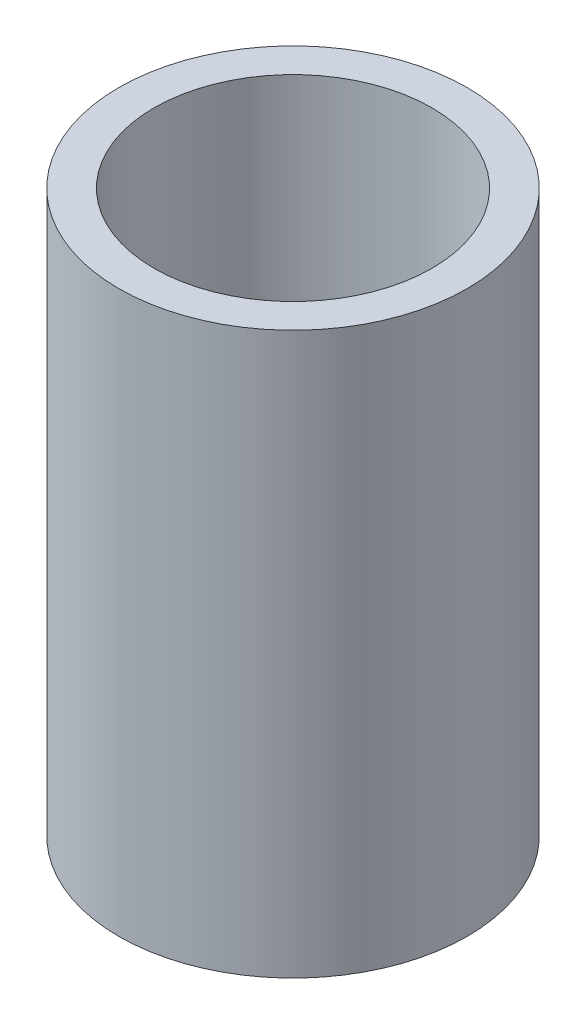
from build123d import *

# Parameters (mm, degrees)
SKETCH1_R           = 15
BOSS_EXTRUDE1_DEPTH = 48.322890663
SKETCH2_R           = 11.972153353
CUT_EXTRUDE1_DEPTH  = 53.774063346


with BuildPart() as part:
    # Sketch1 → Boss-Extrude1 (new body)
    with BuildSketch(Plane(origin=(0, 0, 0), x_dir=(1, 0, 0), z_dir=(0, 1, 0))):
        Circle(SKETCH1_R)
    extrude(amount=BOSS_EXTRUDE1_DEPTH)

    # Sketch2 → Cut-Extrude1 (cut, through all)
    with BuildSketch(Plane(origin=(0, 0, 0), x_dir=(1, 0, 0), z_dir=(0, 1, 0))):
        Circle(SKETCH2_R)
    extrude(amount=CUT_EXTRUDE1_DEPTH, mode=Mode.SUBTRACT)


solid = part.part
